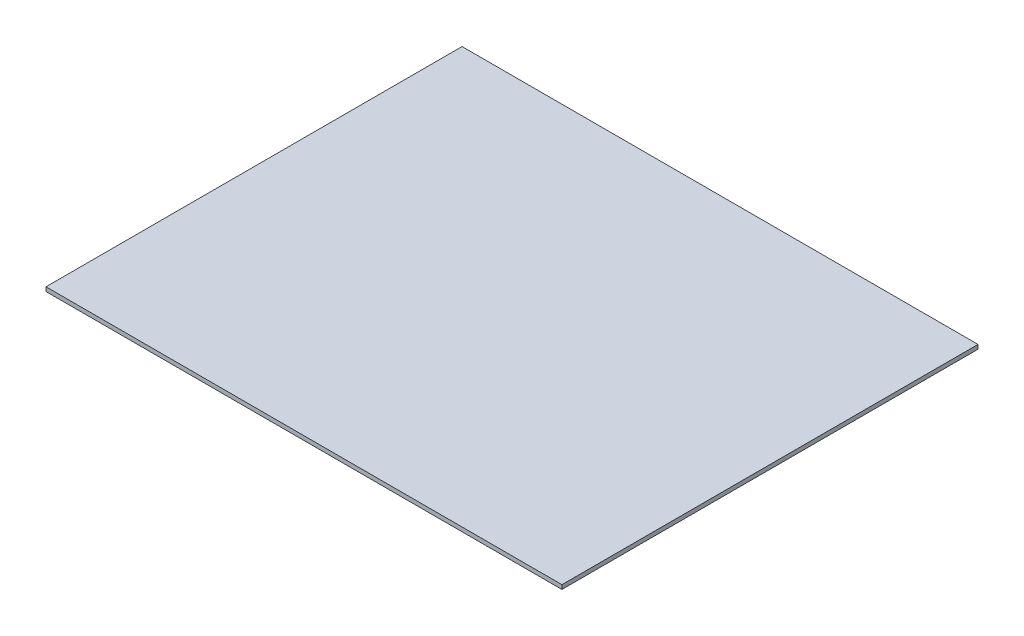
from build123d import *

# Parameters (mm, degrees)
SKETCH1_W           = 393.7
SKETCH1_H           = 317.5
BOSS_EXTRUDE1_DEPTH = 3.175


with BuildPart() as part:
    # Sketch1 → Boss-Extrude1 (new body)
    with BuildSketch(Plane(origin=(0, 0, 0), x_dir=(1, 0, 0), z_dir=(0, 1, 0))):
        Rectangle(SKETCH1_W, SKETCH1_H)
    extrude(amount=BOSS_EXTRUDE1_DEPTH)


solid = part.part
